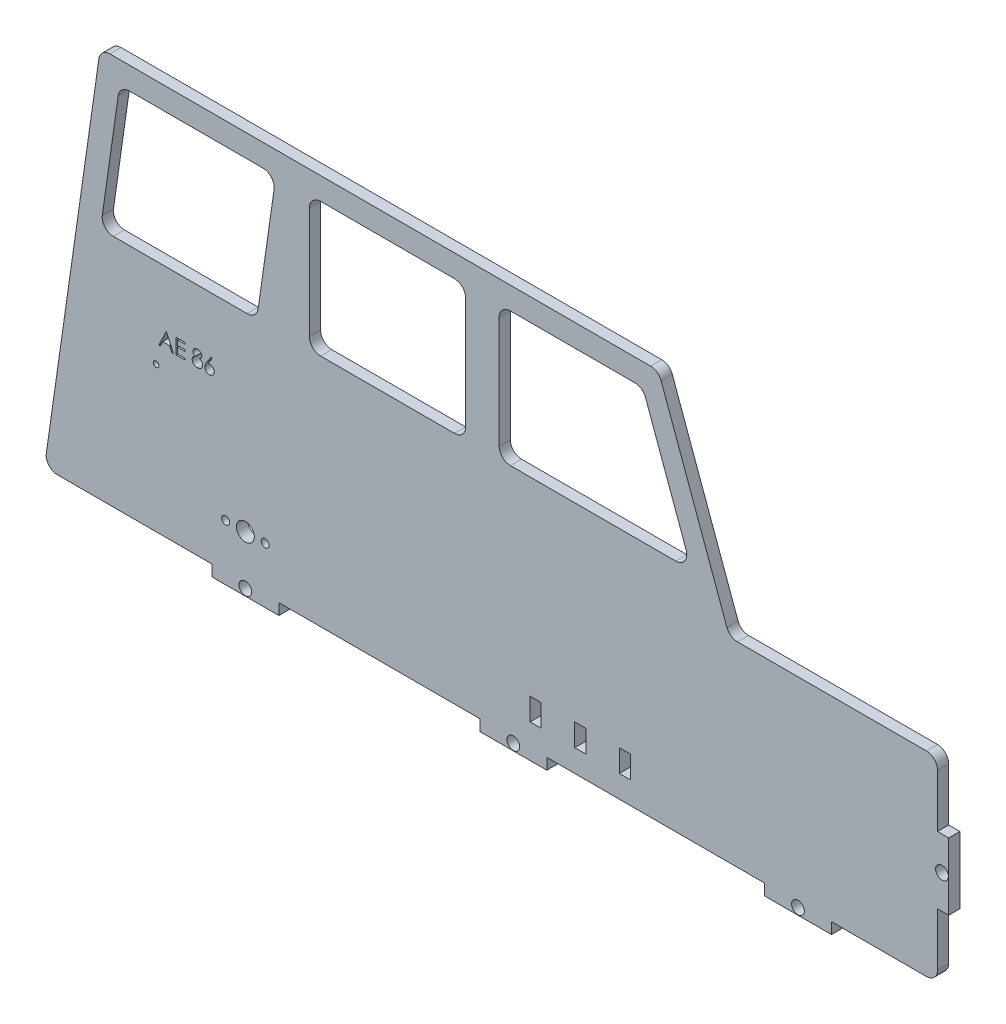
from build123d import *

# Parameters (mm, degrees)
BOSS_EXTRUDE1_DEPTH = 2.54
CUT_EXTRUDE1_REACH  = 139.823
SKETCH2_W           = 35.56
SKETCH2_H           = 30.48
FILLET1_R           = 2.54
FILLET3_R           = 2.54
CUT_EXTRUDE2_REACH  = 139.823
SKETCH4_R           = 1.4478
CUT_EXTRUDE3_REACH  = 139.823
SKETCH5_W           = 2.54
SKETCH5_H           = 5.08
CUT_EXTRUDE4_REACH  = 139.823
SKETCH8_R           = 0.635
CUT_EXTRUDE5_REACH  = 139.823
SKETCH9_R           = 2.032
SKETCH9_R_2         = 0.89916
LOGO_START          = -2.54
LOGO_DEPTH          = 2.54


# Read off the part's stored shape, not the designer's step: Logo
with BuildPart() as part:
    # Sketch1 → Boss-Extrude1 (new body)
    with BuildSketch(Plane.XY):
        Polygon((-63.5, 44.45), (63.5, 44.45), (79.678476913, 0), (127, 0), (127, -14.605), (129.54, -14.605), (129.54, -29.845), (127, -29.845), (127, -44.45), (102.87, -44.45), (102.87, -46.99), (87.63, -46.99), (87.63, -44.45), (63.5, -44.45), (38.1, -44.45), (38.1, -46.99), (22.86, -46.99), (22.86, -44.45), (-22.86, -44.45), (-22.86, -46.99), (-38.1, -46.99), (-38.1, -44.45), (-63.5, -44.45), (-76.2, -44.45), align=None)
    extrude(amount=BOSS_EXTRUDE1_DEPTH)

    # Sketch2 → Cut-Extrude1 (cut, up to next)
    with BuildSketch(Plane.XY.offset(2.54), mode=Mode.PRIVATE) as cut_extrude1_sk1:
        Polygon((-59.094139359, 39.37), (-63.448425074, 8.89), (-27.888425074, 8.89), (-23.534139359, 39.37), align=None)
    cut_extrude1_tool1 = extrude(cut_extrude1_sk1.sketch, amount=-CUT_EXTRUDE1_REACH, mode=Mode.PRIVATE) & part.part
    # Sketch2 → Cut-Extrude1 (cut, up to next)
    with BuildSketch(Plane.XY.offset(2.54), mode=Mode.PRIVATE) as cut_extrude1_sk2:
        Polygon((27.265860641, 39.37), (27.265860641, 8.89), (71.036758446, 8.89), (59.942945706, 39.37), align=None)
    cut_extrude1_tool2 = extrude(cut_extrude1_sk2.sketch, amount=-CUT_EXTRUDE1_REACH, mode=Mode.PRIVATE) & part.part
    # Sketch2 → Cut-Extrude1 (cut, up to next)
    with BuildSketch(Plane.XY.offset(2.54), mode=Mode.PRIVATE) as cut_extrude1_sk3:
        with Locations((1.865860641, 24.13)):
            Rectangle(SKETCH2_W, SKETCH2_H)
    cut_extrude1_tool3 = extrude(cut_extrude1_sk3.sketch, amount=-CUT_EXTRUDE1_REACH, mode=Mode.PRIVATE) & part.part
    add(cut_extrude1_tool1.solids().sort_by_distance((-43.491282, 24.13, 2.54))[0], mode=Mode.SUBTRACT)
    add(cut_extrude1_tool2.solids().sort_by_distance((46.512014, 23.392812, 2.54))[0], mode=Mode.SUBTRACT)
    add(cut_extrude1_tool3.solids().sort_by_distance((1.865861, 24.13, 2.54))[0], mode=Mode.SUBTRACT)

    # Fillet1
    fillet1_edges = [part.edges().sort_by_distance(p)[0] for p in [
        (-59.094139359, 39.37, 1.27),
        (-23.534139359, 39.37, 1.27),
        (-27.888425074, 8.89, 1.27),
        (-63.448425074, 8.89, 1.27),
        (-15.914139359, 8.89, 1.27),
        (-15.914139359, 39.37, 1.27),
        (19.645860641, 39.37, 1.27),
        (19.645860641, 8.89, 1.27),
        (27.265860641, 39.37, 1.27),
        (59.942945706, 39.37, 1.27),
        (71.036758446, 8.89, 1.27),
        (27.265860641, 8.89, 1.27),
    ]]
    fillet(fillet1_edges, radius=FILLET1_R)

    # Fillet3
    fillet3_edges = [part.edges().sort_by_distance(p)[0] for p in [
        (-76.2, -44.45, 1.27),
        (-63.5, 44.45, 1.27),
        (63.5, 44.45, 1.27),
        (79.678476913, 0, 1.27),
        (127, 0, 1.27),
        (127, -44.45, 1.27),
    ]]
    fillet(fillet3_edges, radius=FILLET3_R)

    # Sketch4 → Cut-Extrude2 (cut, up to next)
    with BuildSketch(Plane.XY.offset(2.54), mode=Mode.PRIVATE) as cut_extrude2_sk1:
        with Locations((95.25, -45.466)):
            Circle(SKETCH4_R)
    cut_extrude2_tool1 = extrude(cut_extrude2_sk1.sketch, amount=-CUT_EXTRUDE2_REACH, mode=Mode.PRIVATE) & part.part
    # Sketch4 → Cut-Extrude2 (cut, up to next)
    with BuildSketch(Plane.XY.offset(2.54), mode=Mode.PRIVATE) as cut_extrude2_sk2:
        with Locations((30.48, -45.466)):
            Circle(SKETCH4_R)
    cut_extrude2_tool2 = extrude(cut_extrude2_sk2.sketch, amount=-CUT_EXTRUDE2_REACH, mode=Mode.PRIVATE) & part.part
    # Sketch4 → Cut-Extrude2 (cut, up to next)
    with BuildSketch(Plane.XY.offset(2.54), mode=Mode.PRIVATE) as cut_extrude2_sk3:
        with Locations((-30.48, -45.466)):
            Circle(SKETCH4_R)
    cut_extrude2_tool3 = extrude(cut_extrude2_sk3.sketch, amount=-CUT_EXTRUDE2_REACH, mode=Mode.PRIVATE) & part.part
    # Sketch4 → Cut-Extrude2 (cut, up to next)
    with BuildSketch(Plane.XY.offset(2.54), mode=Mode.PRIVATE) as cut_extrude2_sk4:
        with Locations((128.016, -22.225)):
            Circle(SKETCH4_R)
    cut_extrude2_tool4 = extrude(cut_extrude2_sk4.sketch, amount=-CUT_EXTRUDE2_REACH, mode=Mode.PRIVATE) & part.part
    add(cut_extrude2_tool1.solids().sort_by_distance((95.25, -45.466, 2.54))[0], mode=Mode.SUBTRACT)
    add(cut_extrude2_tool2.solids().sort_by_distance((30.48, -45.466, 2.54))[0], mode=Mode.SUBTRACT)
    add(cut_extrude2_tool3.solids().sort_by_distance((-30.48, -45.466, 2.54))[0], mode=Mode.SUBTRACT)
    add(cut_extrude2_tool4.solids().sort_by_distance((128.016, -22.225, 2.54))[0], mode=Mode.SUBTRACT)

    # Sketch5 → Cut-Extrude3 (cut, up to next)
    with BuildSketch(Plane.XY.offset(2.54), mode=Mode.PRIVATE) as cut_extrude3_sk1:
        with Locations((45.72, -36.83)):
            Rectangle(SKETCH5_W, SKETCH5_H)
    cut_extrude3_tool1 = extrude(cut_extrude3_sk1.sketch, amount=-CUT_EXTRUDE3_REACH, mode=Mode.PRIVATE) & part.part
    # Sketch5 → Cut-Extrude3 (cut, up to next)
    with BuildSketch(Plane.XY.offset(2.54), mode=Mode.PRIVATE) as cut_extrude3_sk2:
        with Locations((55.88, -36.83)):
            Rectangle(SKETCH5_W, SKETCH5_H)
    cut_extrude3_tool2 = extrude(cut_extrude3_sk2.sketch, amount=-CUT_EXTRUDE3_REACH, mode=Mode.PRIVATE) & part.part
    # Sketch5 → Cut-Extrude3 (cut, up to next)
    with BuildSketch(Plane.XY.offset(2.54), mode=Mode.PRIVATE) as cut_extrude3_sk3:
        with Locations((35.56, -36.83)):
            Rectangle(SKETCH5_W, SKETCH5_H)
    cut_extrude3_tool3 = extrude(cut_extrude3_sk3.sketch, amount=-CUT_EXTRUDE3_REACH, mode=Mode.PRIVATE) & part.part
    add(cut_extrude3_tool1.solids().sort_by_distance((45.72, -36.83, 2.54))[0], mode=Mode.SUBTRACT)
    add(cut_extrude3_tool2.solids().sort_by_distance((55.88, -36.83, 2.54))[0], mode=Mode.SUBTRACT)
    add(cut_extrude3_tool3.solids().sort_by_distance((35.56, -36.83, 2.54))[0], mode=Mode.SUBTRACT)

    # Sketch8 → Cut-Extrude4 (cut, up to next)
    with BuildSketch(Plane.XY.offset(2.54), mode=Mode.PRIVATE) as cut_extrude4_sk1:
        with Locations((-50.8, -11.43)):
            Circle(SKETCH8_R)
    cut_extrude4_tool1 = extrude(cut_extrude4_sk1.sketch, amount=-CUT_EXTRUDE4_REACH, mode=Mode.PRIVATE) & part.part
    add(cut_extrude4_tool1.solids().sort_by_distance((-50.8, -11.43, 2.54))[0], mode=Mode.SUBTRACT)

    # Sketch9 → Cut-Extrude5 (cut, up to next)
    with BuildSketch(Plane.XY.offset(2.54), mode=Mode.PRIVATE) as cut_extrude5_sk1:
        with Locations((-30.48, -34.29)):
            Circle(SKETCH9_R)
    cut_extrude5_tool1 = extrude(cut_extrude5_sk1.sketch, amount=-CUT_EXTRUDE5_REACH, mode=Mode.PRIVATE) & part.part
    # Sketch9 → Cut-Extrude5 (cut, up to next)
    with BuildSketch(Plane.XY.offset(2.54), mode=Mode.PRIVATE) as cut_extrude5_sk2:
        with Locations((-25.9842, -34.29)):
            Circle(SKETCH9_R_2)
    cut_extrude5_tool2 = extrude(cut_extrude5_sk2.sketch, amount=-CUT_EXTRUDE5_REACH, mode=Mode.PRIVATE) & part.part
    # Sketch9 → Cut-Extrude5 (cut, up to next)
    with BuildSketch(Plane.XY.offset(2.54), mode=Mode.PRIVATE) as cut_extrude5_sk3:
        with Locations(Location((-34.9758, -34.29, 0), (0, 0, 180))):
            Circle(SKETCH9_R_2)
    cut_extrude5_tool3 = extrude(cut_extrude5_sk3.sketch, amount=-CUT_EXTRUDE5_REACH, mode=Mode.PRIVATE) & part.part
    add(cut_extrude5_tool1.solids().sort_by_distance((-30.48, -34.29, 2.54))[0], mode=Mode.SUBTRACT)
    add(cut_extrude5_tool2.solids().sort_by_distance((-25.9842, -34.29, 2.54))[0], mode=Mode.SUBTRACT)
    add(cut_extrude5_tool3.solids().sort_by_distance((-34.9758, -34.29, 2.54))[0], mode=Mode.SUBTRACT)

    # Logo outline → Logo (cut)
    with BuildSketch(Plane.XY.offset(2.54).offset(LOGO_START)):
        with BuildLine():
            add(Edge.make_bspline(
                [(-38.959823252, -5.362055293), (-38.898252975, -5.352241432), (-38.778153188, -5.333098387), (-38.65658729, -5.329940442), (-38.597343284, -5.328401447)],
                knots=[0, 0, 0, 0, 0.512659336, 1, 1, 1, 1], degree=3))
            Line((-38.959823252, -5.362055293), (-38.035043605, -3.947892633))
            Line((-38.035043605, -3.947892633), (-38.276930624, -3.757888626))
            Line((-38.276930624, -3.757888626), (-39.321602098, -5.355044075))
            add(Edge.make_bspline(
                [(-39.71282806, -6.371670678), (-39.711646615, -6.335626094), (-39.70923433, -6.262029942), (-39.69239094, -6.150565914), (-39.665326145, -6.036514833), (-39.635015898, -5.939760639), (-39.602990288, -5.860499117), (-39.576337749, -5.796595626), (-39.543163753, -5.730834553), (-39.507790372, -5.660960917), (-39.467033503, -5.588775485), (-39.422717853, -5.513071815), (-39.373618202, -5.435053887), (-39.33919804, -5.382109692), (-39.321602098, -5.355044075)],
                knots=[0, 0, 0, 0, 0.09781819, 0.199726053, 0.305276357, 0.415811491, 0.474472231, 0.53727388, 0.603657421, 0.674298863, 0.749834485, 0.828598477, 0.912377778, 1, 1, 1, 1], degree=3))
            add(Edge.make_bspline(
                [(-38.652731906, -7.437375806), (-38.699828607, -7.4358476), (-38.793118925, -7.432820492), (-38.930351719, -7.405854554), (-39.062214736, -7.362147451), (-39.187784117, -7.301933173), (-39.30410473, -7.22587529), (-39.408170367, -7.134313011), (-39.499462141, -7.029203546), (-39.575436762, -6.910563198), (-39.635695494, -6.783073241), (-39.680885419, -6.650136084), (-39.707281662, -6.512236103), (-39.710970219, -6.418754964), (-39.71282806, -6.371670678)],
                knots=[0, 0, 0, 0, 0.084334722, 0.167052318, 0.249566077, 0.332740482, 0.415914886, 0.49782801, 0.580372589, 0.664600121, 0.749466693, 0.832510234, 0.915639282, 1, 1, 1, 1], degree=3))
            add(Edge.make_bspline(
                [(-37.558981906, -6.365360581), (-37.560405011, -6.414340285), (-37.563205345, -6.510720751), (-37.591109141, -6.651097458), (-37.634468785, -6.784829973), (-37.696446314, -6.909783145), (-37.773428697, -7.025785714), (-37.867306289, -7.12857118), (-37.974749778, -7.220241217), (-38.096236576, -7.296897836), (-38.22697954, -7.359500887), (-38.364331537, -7.404466129), (-38.506958684, -7.432149599), (-38.603763292, -7.435620201), (-38.652731906, -7.437375806)],
                knots=[0, 0, 0, 0, 0.085947943, 0.169125212, 0.250399107, 0.332289736, 0.413364288, 0.494172283, 0.576021735, 0.660756969, 0.745783126, 0.830043593, 0.914027546, 1, 1, 1, 1], degree=3))
            add(Edge.make_bspline(
                [(-38.597343284, -5.328401447), (-38.561770788, -5.329357558), (-38.491747387, -5.331239636), (-38.388940585, -5.345723487), (-38.290151649, -5.368548599), (-38.195790037, -5.401820854), (-38.105517055, -5.444323209), (-38.018814659, -5.495262079), (-37.937312649, -5.557267759), (-37.85996147, -5.626532715), (-37.789734372, -5.7032497), (-37.727558317, -5.784651036), (-37.675331525, -5.870651917), (-37.632957603, -5.961208783), (-37.600052725, -6.056182043), (-37.57606508, -6.155450182), (-37.561885487, -6.259081654), (-37.559959996, -6.329559829), (-37.558981906, -6.365360581)],
                knots=[0, 0, 0, 0, 0.065230804, 0.128404896, 0.190067072, 0.250943366, 0.311545833, 0.372862802, 0.435023674, 0.499071725, 0.563091075, 0.625510106, 0.686680036, 0.747282503, 0.808563495, 0.870742104, 0.934340952, 1, 1, 1, 1], degree=3))
        make_face()
        with BuildLine():
            add(Edge.make_bspline(
                [(-40.206417803, -6.328201126), (-40.207189224, -6.361898859), (-40.208716155, -6.428599316), (-40.222016139, -6.527045427), (-40.241929117, -6.622657209), (-40.27100863, -6.7154137), (-40.30872202, -6.804803073), (-40.355198856, -6.890901847), (-40.407810061, -6.975121156), (-40.450062301, -7.026940558), (-40.471441842, -7.053161062)],
                knots=[0, 0, 0, 0, 0.128158186, 0.253673136, 0.377325306, 0.499384555, 0.622918368, 0.745839393, 0.871395285, 1, 1, 1, 1], degree=3))
            add(Edge.make_bspline(
                [(-40.883000336, -5.397812504), (-40.854351788, -5.41275046), (-40.798477554, -5.441884463), (-40.718900346, -5.488795291), (-40.646175344, -5.538236256), (-40.578284783, -5.587872115), (-40.516421432, -5.639603767), (-40.461277019, -5.693636923), (-40.411489399, -5.748622868), (-40.368062615, -5.805492708), (-40.329865778, -5.864095357), (-40.296853643, -5.92458463), (-40.26863644, -5.986827964), (-40.246273501, -6.051504794), (-40.22785171, -6.117665056), (-40.215176105, -6.186163038), (-40.208359187, -6.256547379), (-40.207070373, -6.30411568), (-40.206417803, -6.328201126)],
                knots=[0, 0, 0, 0, 0.07952483, 0.155099976, 0.22721982, 0.295910504, 0.362055881, 0.425520117, 0.485812719, 0.544494706, 0.601459636, 0.657840594, 0.713974472, 0.769467952, 0.826129967, 0.882885359, 0.940700882, 1, 1, 1, 1], degree=3))
            add(Edge.make_bspline(
                [(-40.385904983, -4.665841351), (-40.387339544, -4.703818014), (-40.390156939, -4.778402024), (-40.413856879, -4.887128544), (-40.453770192, -4.988950583), (-40.508264355, -5.085023535), (-40.579289843, -5.173605033), (-40.665898576, -5.255821503), (-40.767400054, -5.332348331), (-40.84366094, -5.375534696), (-40.883000336, -5.397812504)],
                knots=[0, 0, 0, 0, 0.121904041, 0.239412608, 0.355410104, 0.472090729, 0.592858982, 0.718703468, 0.854892383, 1, 1, 1, 1], degree=3))
            add(Edge.make_bspline(
                [(-41.379394566, -3.757888626), (-41.334890751, -3.759334969), (-41.247134298, -3.762186993), (-41.118139671, -3.785973871), (-40.994714793, -3.825703391), (-40.877285294, -3.879600614), (-40.767953427, -3.945987555), (-40.671351118, -4.026388429), (-40.586018536, -4.11652998), (-40.515434141, -4.217449583), (-40.457271252, -4.324133777), (-40.416770351, -4.435756298), (-40.390818377, -4.549905357), (-40.387545013, -4.627143361), (-40.385904983, -4.665841351)],
                knots=[0, 0, 0, 0, 0.089409711, 0.176305764, 0.262625902, 0.349445726, 0.435498264, 0.51892813, 0.601354657, 0.684256422, 0.76580674, 0.844876866, 0.922279795, 1, 1, 1, 1], degree=3))
            add(Edge.make_bspline(
                [(-42.405135752, -4.656025645), (-42.403500328, -4.618728087), (-42.40021284, -4.54375349), (-42.37362952, -4.432147367), (-42.330309453, -4.322530802), (-42.271388456, -4.215435089), (-42.19800124, -4.114484874), (-42.109954694, -4.023943928), (-42.009351398, -3.944632446), (-41.896693531, -3.878056273), (-41.775457295, -3.823872614), (-41.647541571, -3.786494191), (-41.515175078, -3.762058075), (-41.425077358, -3.75929142), (-41.379394566, -3.757888626)],
                knots=[0, 0, 0, 0, 0.074058426, 0.148870352, 0.226667668, 0.307734759, 0.391157204, 0.473929356, 0.557927752, 0.64498929, 0.733364056, 0.821092042, 0.909287215, 1, 1, 1, 1], degree=3))
            add(Edge.make_bspline(
                [(-41.894017964, -5.397812504), (-41.934609338, -5.375677736), (-42.013205601, -5.332818628), (-42.117275042, -5.254071822), (-42.206665666, -5.168784007), (-42.278920383, -5.075154213), (-42.335792612, -4.976107338), (-42.374811216, -4.872263086), (-42.4012077, -4.765546972), (-42.403822527, -4.692640776), (-42.405135752, -4.656025645)],
                knots=[0, 0, 0, 0, 0.14586006, 0.282425903, 0.4108504, 0.535029421, 0.654701078, 0.770133433, 0.884555844, 1, 1, 1, 1], degree=3))
            add(Edge.make_bspline(
                [(-42.584622932, -6.35694712), (-42.584045051, -6.332387928), (-42.582902954, -6.283850296), (-42.574998106, -6.212140968), (-42.562289644, -6.142344833), (-42.545030187, -6.074204089), (-42.521639161, -6.008214817), (-42.493397028, -5.944064343), (-42.460465075, -5.881680244), (-42.42238391, -5.820721363), (-42.378081886, -5.762041851), (-42.327918237, -5.704645856), (-42.270890368, -5.649423989), (-42.207632709, -5.595701564), (-42.13886817, -5.54252559), (-42.062810639, -5.492769862), (-41.981476371, -5.442911897), (-41.923670966, -5.413103571), (-41.894017964, -5.397812504)],
                knots=[0, 0, 0, 0, 0.058853586, 0.116315459, 0.172674843, 0.228780387, 0.284580359, 0.340256506, 0.396629805, 0.453507263, 0.51231819, 0.572648444, 0.636021936, 0.702362946, 0.771483056, 0.844184477, 0.920069794, 1, 1, 1, 1], degree=3))
            add(Edge.make_bspline(
                [(-41.40042822, -7.437375806), (-41.447441609, -7.436223328), (-41.538924888, -7.433980723), (-41.672082765, -7.418786291), (-41.796205835, -7.392158425), (-41.912015803, -7.355713815), (-42.018814497, -7.308303587), (-42.116297598, -7.249295178), (-42.20587157, -7.181063736), (-42.284818044, -7.101649658), (-42.354906488, -7.016591785), (-42.416474541, -6.928840176), (-42.467648619, -6.838386818), (-42.510975715, -6.746580451), (-42.544143737, -6.652134297), (-42.567115948, -6.555534284), (-42.581705262, -6.456949141), (-42.583646397, -6.390417488), (-42.584622932, -6.35694712)],
                knots=[0, 0, 0, 0, 0.078556433, 0.15286284, 0.223559693, 0.290374944, 0.355403073, 0.418291157, 0.480388564, 0.543072615, 0.604923944, 0.664398309, 0.721942555, 0.778374891, 0.833829941, 0.888861236, 0.94408894, 1, 1, 1, 1], degree=3))
            add(Edge.make_bspline(
                [(-40.471441842, -7.053161062), (-40.499278316, -7.083754836), (-40.554607282, -7.144564329), (-40.649390209, -7.223515139), (-40.753412093, -7.289864533), (-40.866270426, -7.343936428), (-40.987663527, -7.386022287), (-41.117565532, -7.416264804), (-41.256229685, -7.433587234), (-41.351535156, -7.436091223), (-41.40042822, -7.437375806)],
                knots=[0, 0, 0, 0, 0.11928345, 0.237092882, 0.354796044, 0.474576301, 0.597460066, 0.724926155, 0.858883199, 1, 1, 1, 1], degree=3))
        make_face()
        Polygon((-45.905135752, -4.206606575), (-44.244879342, -4.206606575), (-44.244879342, -3.847632216), (-46.219238316, -3.847632216), (-46.219238316, -7.347632216), (-44.244879342, -7.347632216), (-44.244879342, -6.988657857), (-45.905135752, -6.988657857), (-45.905135752, -5.642504011), (-44.244879342, -5.642504011), (-44.244879342, -5.283529652), (-45.905135752, -5.283529652), align=None)
        Polygon((-47.706317643, -6.225837344), (-47.188889759, -7.347632216), (-46.847443445, -7.347632216), (-48.46282806, -3.847632216), (-48.507699855, -3.847632216), (-50.167956265, -7.347632216), (-49.825107707, -7.347632216), (-49.292956265, -6.225837344), align=None)
    extrude(amount=LOGO_DEPTH, mode=Mode.SUBTRACT)


solid = part.part
